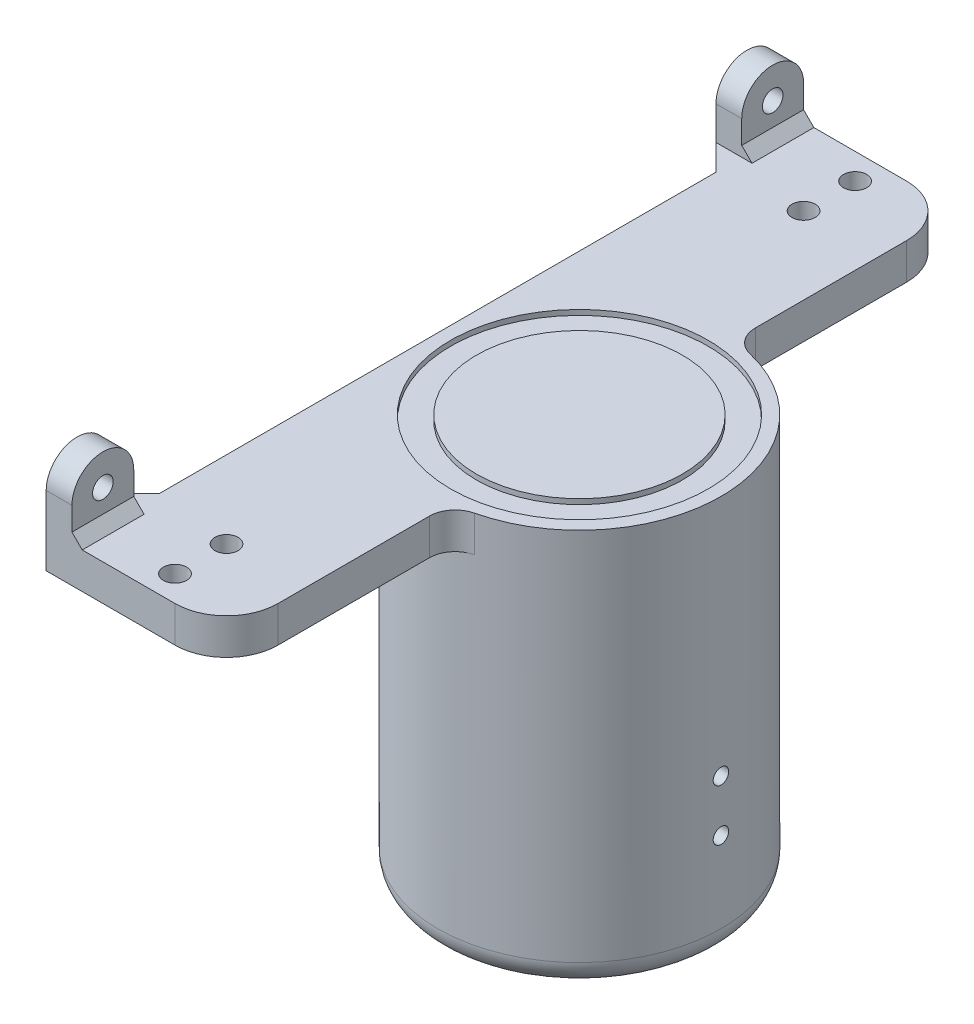
from build123d import *

# Parameters (mm, degrees)
CROQUIS1_R                          = 3
SALIENTE_EXTRUIR1_DEPTH             = 20
SALIENTE_EXTRUIR1_2_DEPTH           = 20
CROQUIS2_W                          = 142
CROQUIS2_H                          = 7
SALIENTE_EXTRUIR2_DEPTH             = 30
CROQUIS3_R                          = 27.5
SALIENTE_EXTRUIR3_DEPTH             = 70
SALIENTE_EXTRUIR3_DIRECTION_2_REACH = 89.121
CROQUIS4_R                          = 25
CORTAR_EXTRUIR1_DEPTH               = 70
CROQUIS5_R                          = 1
CORTAR_EXTRUIR2_DEPTH               = 5
CROQUIS6_R                          = 2.25
CORTAR_EXTRUIR3_DEPTH               = 10
REDONDEO1_R                         = 10
CORTAR_EXTRUIR4_DEPTH               = 117.052789712
CROQUIS8_R                          = 2
SALIENTE_EXTRUIR4_DEPTH             = 5
REDONDEO3_R                         = 5
CHAFL_N2_SIZE                       = 5
CHAFL_N1_SIZE                       = 2
CROQUIS9_R                          = 1.5
CORTAR_EXTRUIR5_DEPTH               = 109.019674134
CORTAR_EXTRUIR6_START               = -1
CROQUIS10_R                         = 25
CROQUIS10_R_2                       = 20
CORTAR_EXTRUIR6_DEPTH               = 1


with BuildPart() as part:
    # Croquis1 → Saliente-Extruir1 (new body)
    with BuildSketch(Plane(origin=(0, 0, 0), x_dir=(0, 0, -1), z_dir=(1, 0, 0))):
        with Locations((-65, 0)):
            Circle(CROQUIS1_R)
    extrude(amount=SALIENTE_EXTRUIR1_DEPTH)



with BuildPart() as body_2:
    # Croquis1 → Saliente-Extruir1 2 (new body)
    with BuildSketch(Plane(origin=(0, 0, 0), x_dir=(0, 0, -1), z_dir=(1, 0, 0))):
        with Locations((65, 0)):
            Circle(CROQUIS1_R)
    extrude(amount=SALIENTE_EXTRUIR1_2_DEPTH)


with BuildPart() as part_1:
    add(part.part)

    add(body_2.part)  # Saliente-Extruir2 merges body 2
    # Croquis2 → Saliente-Extruir2 (add)
    with BuildSketch(Plane(origin=(20, 0, 0), x_dir=(0, 0, -1), z_dir=(1, 0, 0))):
        Rectangle(CROQUIS2_W, CROQUIS2_H)
    extrude(amount=SALIENTE_EXTRUIR2_DEPTH)

    # Croquis3 → Saliente-Extruir3 (add)
    with BuildSketch(Plane.XZ.offset(3.5)):
        with Locations(Location((47.5, 0, 0), (0, 0, 270))):
            Circle(CROQUIS3_R)
    extrude(amount=SALIENTE_EXTRUIR3_DEPTH)

    # Saliente-Extruir3 direction 2: up to this face of the body (flat: up to its plane)
    saliente_extruir3_direction_2_end = Plane(part_1.part.faces().sort_by_distance((35, 3.5, 0))[0])
    # Croquis3 → Saliente-Extruir3 direction 2 (add, up to the picked face)
    with BuildSketch(Plane.XZ.offset(3.5), mode=Mode.PRIVATE) as saliente_extruir3_direction_2_sk1:
        with Locations(Location((47.5, 0, 0), (0, 0, 270))):
            Circle(CROQUIS3_R)
    saliente_extruir3_direction_2_tool1 = split(extrude(saliente_extruir3_direction_2_sk1.sketch, amount=-SALIENTE_EXTRUIR3_DIRECTION_2_REACH, mode=Mode.PRIVATE), bisect_by=saliente_extruir3_direction_2_end, keep=Keep.BOTH, mode=Mode.PRIVATE)
    add(saliente_extruir3_direction_2_tool1.solids().sort_by(Axis((47.5, -3.5, 0), (0, 1, 0)))[0])

    # Croquis4 → Cortar-Extruir1 (cut)
    with BuildSketch(Plane.XZ.offset(73.5)):
        with Locations(Location((47.5, 0, 0), (0, 0, 270))):
            Circle(CROQUIS4_R)
    extrude(amount=-CORTAR_EXTRUIR1_DEPTH, mode=Mode.SUBTRACT)

    # Croquis5 → Cortar-Extruir2 (cut)
    with BuildSketch(Plane.ZY):
        with Locations((-65, 0)):
            Circle(CROQUIS5_R)
        with Locations((65, 0)):
            Circle(CROQUIS5_R)
    extrude(amount=-CORTAR_EXTRUIR2_DEPTH, mode=Mode.SUBTRACT)

    # Croquis6 → Cortar-Extruir3 (cut)
    with BuildSketch(Plane(origin=(0, 3.5, 0), x_dir=(1, 0, 0), z_dir=(0, 1, 0))):
        with Locations(Location((35, 66, 0), (0, 0, 270))):
            Circle(CROQUIS6_R)
        with Locations(Location((35, 56, 0), (0, 0, 270))):
            Circle(CROQUIS6_R)
        with Locations(Location((35, -66, 0), (0, 0, 270))):
            Circle(CROQUIS6_R)
        with Locations(Location((35, -56, 0), (0, 0, 270))):
            Circle(CROQUIS6_R)
    extrude(amount=-CORTAR_EXTRUIR3_DEPTH, mode=Mode.SUBTRACT)

    # Redondeo1
    redondeo1_edges = [part_1.edges().sort_by_distance(p)[0] for p in [
        (50, 0, 71),
        (50, 0, -71),
    ]]
    fillet(redondeo1_edges, radius=REDONDEO1_R)

    # Croquis7 → Cortar-Extruir4 (cut, through all)
    with BuildSketch(Plane.ZY.offset(-20)):
        Polygon((-71, -3.5), (0, -3.5), (71, -3.5), (71, 3.5), (-71, 3.5), align=None)
    extrude(amount=CORTAR_EXTRUIR4_DEPTH, mode=Mode.SUBTRACT)

    # Croquis8 → Saliente-Extruir4 (add)
    # profile 1 of 2: a face of its own
    with BuildSketch(Plane.ZY.offset(-20)):
        with BuildLine():
            Line((-71, 10), (-71, -3.5))
            Line((-71, -3.5), (-59, -3.5))
            Line((-59, -3.5), (-59, 10))
            ThreePointArc((-59, 10), (-65, 16), (-71, 10))
        make_face()
        with Locations((-65, 10)):
            Circle(CROQUIS8_R, mode=Mode.SUBTRACT)
    # profile 2 of 2: a face of its own
    with BuildSketch(Plane.ZY.offset(-20)):
        with BuildLine():
            Line((59, 10), (59, -3.5))
            Line((59, -3.5), (71, -3.5))
            Line((71, -3.5), (71, 10))
            ThreePointArc((71, 10), (65, 16), (59, 10))
        make_face()
        with Locations(Location((65, 10, 0), (0, 0, 180))):
            Circle(CROQUIS8_R, mode=Mode.SUBTRACT)
    extrude(amount=SALIENTE_EXTRUIR4_DEPTH)

    # Redondeo3
    # the kernel refuses this fillet: 5 mm, written as the material it adds along each edge
    with BuildSketch(Plane(origin=(50, 3.5, -27.386127875), x_dir=(0, 0, -1), z_dir=(0, -1, 0))) as redondeo3_piece_1:
        with BuildLine():
            CenterArc((4.236648726, 5), REDONDEO3_R, 193.342363797, 76.657636203)
            ThreePointArc((-0.628393828, 3.846153846), (-0.245979187, 1.934222499), (0, 0))
            Line((0, 0), (4.236648726, 0))
        make_face()
    extrude(amount=7)
    with BuildSketch(Plane(origin=(50, 3.5, 27.386127875), x_dir=(0.9869144977622896, 0, -0.16124445449877534), z_dir=(0, -1, 0))) as redondeo3_piece_2:
        with BuildLine():
            CenterArc((4.251436376, 4.987432323), REDONDEO3_R, 189.279136184, 76.657636203)
            Line((-0.683136113, 4.18121005), (0, 0))
            ThreePointArc((0, 0), (1.948575006, 0.069122226), (3.897150011, 0))
        make_face()
    extrude(amount=7)
    # the kernel refuses this fillet: 5 mm, written as the material it takes off along each edge
    with BuildSketch(Plane(origin=(47.5, -73.5, 0), x_dir=(0, 0, -1), z_dir=(-1, 0, 0))) as redondeo3_2_piece_1:
        with BuildLine():
            CenterArc((22.5, -4.330127019), REDONDEO3_R, 0, 60)
            Line((25, 0), (27.5, 0))
            Line((27.5, 0), (27.5, -4.330127019))
        make_face()
    revolve(axis=Axis((47.5, -73.5, 0), (0, -1, 0)), mode=Mode.SUBTRACT)

    # Chaflán2
    # the kernel refuses this chamfer: 5 mm, written as the material it adds along each edge
    with BuildSketch(Plane(origin=(20, 3.5, 59), x_dir=(0, 0, -1), z_dir=(0, -1, 0)), Plane(origin=(20, -3.5, -59), x_dir=(0, 0, 1), z_dir=(0, 1, 0))) as chafl_n2_piece_1:
        Polygon((CHAFL_N2_SIZE, 0), (0, -CHAFL_N2_SIZE), (0, 0), align=None)
    extrude(amount=7)

    # Chaflán1
    chafl_n1_edges = [part_1.edges().sort_by_distance(p)[0] for p in [
        (20, 3.5, 65),
        (20, 3.5, -65),
    ]]
    chamfer(chafl_n1_edges, length=CHAFL_N1_SIZE)

    # Croquis9 → Cortar-Extruir5 (cut, through all)
    with BuildSketch(Plane(origin=(50, 0, 0), x_dir=(0, 0, -1), z_dir=(1, 0, 0))):
        with Locations(Location((0, -53.5, 0), (0, 0, 180))):
            Circle(CROQUIS9_R)
        with Locations(Location((0, -43.5, 0), (0, 0, 180))):
            Circle(CROQUIS9_R)
    extrude(amount=CORTAR_EXTRUIR5_DEPTH, mode=Mode.SUBTRACT)

    # Croquis10 → Cortar-Extruir6 (cut)
    with BuildSketch(Plane(origin=(0, 3.5, 0), x_dir=(1, 0, 0), z_dir=(0, 1, 0)).offset(CORTAR_EXTRUIR6_START)):
        with Locations(Location((47.5, 0, 0), (0, 0, 90))):
            Circle(CROQUIS10_R)
        with Locations(Location((47.5, 0, 0), (0, 0, 270))):
            Circle(CROQUIS10_R_2, mode=Mode.SUBTRACT)
    extrude(amount=CORTAR_EXTRUIR6_DEPTH, mode=Mode.SUBTRACT)


solid = part_1.part
